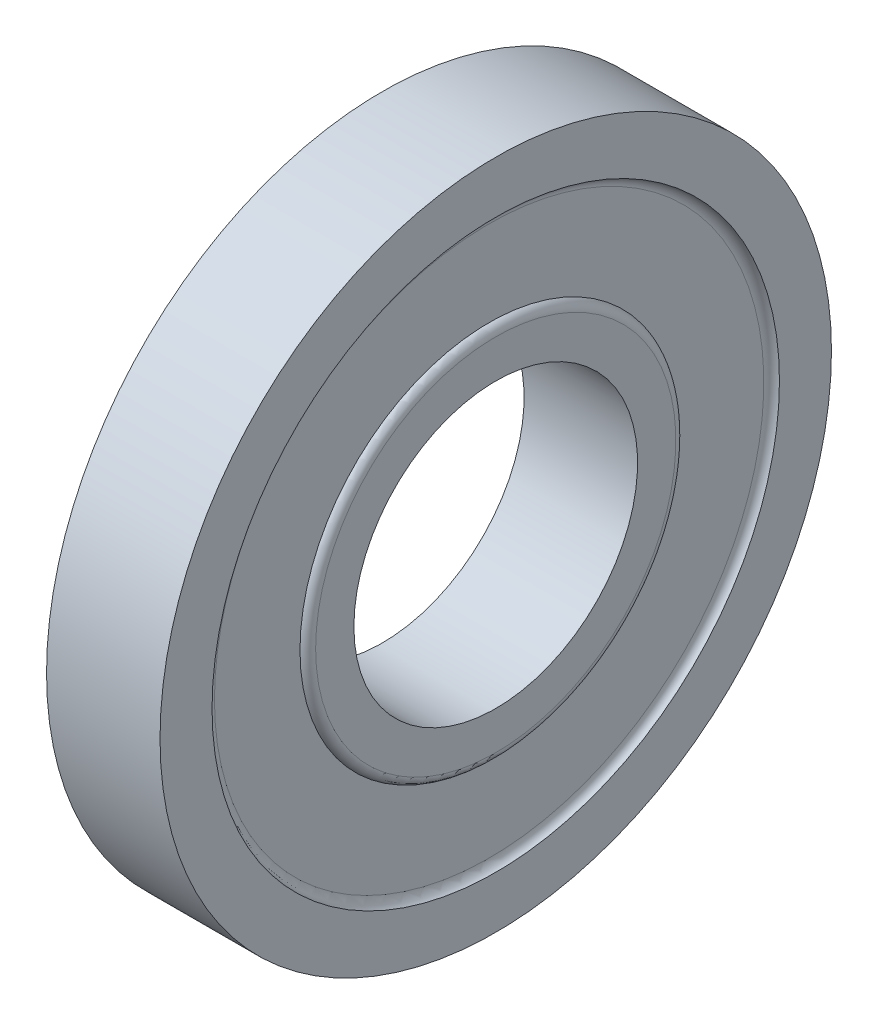
from build123d import *

# Parameters (mm, degrees)
FILLET1_R = 1


with BuildPart() as part:
    # Sketch3 → Revolve1 (revolve)
    with BuildSketch(Plane.XY, mode=Mode.PRIVATE) as revolve1_sk:
        Polygon((6, 15), (-6, 15), (-6, 20), (-5.3, 20), (-5.3, 30), (-6, 30), (-6, 35.5), (6, 35.5), (6, 30), (5.3, 30), (5.3, 20), (6, 20), align=None)
    revolve(revolve1_sk.sketch.rotate(Axis((-14.54061226, 0, 0), (1, 0, 0)), 90), axis=Axis((-14.54061226, 0, 0), (1, 0, 0)))

    # Fillet1
    # the kernel refuses this fillet: 1 mm, written as the material it adds along each edge
    with BuildSketch(Plane(origin=(5.3, 0, 0), x_dir=(0, 0, 1), z_dir=(0, 1, 0))) as fillet1_piece_1:
        with BuildLine():
            CenterArc((29.046060799, 1), FILLET1_R, 270, 72.542396876)
            Line((29.046060799, 0), (29.046060799, -0.02))
            Line((29.046060799, -0.02), (30, -0.02))
            Line((30, -0.02), (30.02, 0))
            ThreePointArc((30.02, 0), (30.02, 0.35), (30.019078784, 0.694))
            Line((30.019078784, 0.694), (30, 0.7))
        make_face()
    revolve(axis=Axis((5.3, 0, 0), (1, 0, 0)))
    with BuildSketch(Plane(origin=(-5.3, 0, 0), x_dir=(0, 0, 1), z_dir=(0, 1, 0))) as fillet1_piece_2:
        with BuildLine():
            CenterArc((29.046060799, -1), FILLET1_R, 17.457603124, 72.542396876)
            Line((30, -0.7), (30.019078784, -0.694))
            ThreePointArc((30.019078784, -0.694), (30.02, -0.35), (30.02, 0))
            Line((30.02, 0), (30, 0.02))
            Line((30, 0.02), (29.046060799, 0.02))
            Line((29.046060799, 0.02), (29.046060799, 0))
        make_face()
    revolve(axis=Axis((-5.3, 0, 0), (1, 0, 0)))
    # the kernel refuses this fillet: 1 mm, written as the material it takes off along each edge
    with BuildSketch(Plane(origin=(6, 0, 0), x_dir=(0, 0, 1), z_dir=(0, 1, 0))) as fillet1_2_piece_1:
        with BuildLine():
            CenterArc((19.046060799, -1), FILLET1_R, 17.457603124, 72.542396876)
            Line((20, -0.7), (20.019078784, -0.694))
            ThreePointArc((20.019078784, -0.694), (20.02, -0.35), (20.02, 0))
            Line((20.02, 0), (20, 0.02))
            Line((20, 0.02), (19.046060799, 0.02))
            Line((19.046060799, 0.02), (19.046060799, 0))
        make_face()
    revolve(axis=Axis((6, 0, 0), (1, 0, 0)), mode=Mode.SUBTRACT)
    with BuildSketch(Plane(origin=(-6, 0, 0), x_dir=(0, 0, 1), z_dir=(0, 1, 0))) as fillet1_2_piece_2:
        with BuildLine():
            CenterArc((19.046060799, 1), FILLET1_R, 270, 72.542396876)
            Line((20, 0.7), (20.019078784, 0.694))
            ThreePointArc((20.019078784, 0.694), (20.02, 0.35), (20.02, 0))
            Line((20.02, 0), (20, -0.02))
            Line((20, -0.02), (19.046060799, -0.02))
            Line((19.046060799, -0.02), (19.046060799, 0))
        make_face()
    revolve(axis=Axis((-6, 0, 0), (1, 0, 0)), mode=Mode.SUBTRACT)


solid = part.part
